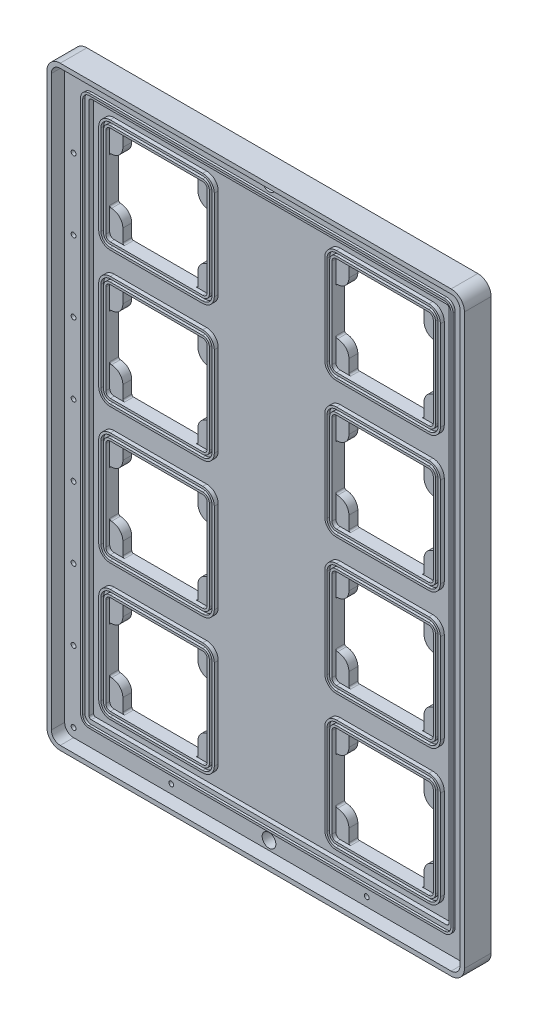
from build123d import *

# Parameters (mm, degrees)
SKETCH1_W            = 292.1
SKETCH1_H            = 419.1
BOSS_EXTRUDE1_DEPTH  = 9.525
SKETCH4_R            = 1.7272
CUT_EXTRUDE1_DEPTH   = 6.985
LPATTERN2_COUNT      = 8
LPATTERN2_PITCH      = 50.8
LPATTERN3_COUNT      = 4
LPATTERN3_PITCH      = 69.85
CUT_EXTRUDE3_DEPTH   = 3.175
BOSS_EXTRUDE2_DEPTH  = 1.5875
SKETCH7_R            = 4.9022
CUT_EXTRUDE4_DEPTH   = 511.938299235
FILLET1_R            = 6.35
CUT_EXTRUDE5_DEPTH   = 3.175
CUT_EXTRUDE6_DEPTH   = 511.970358882
SKETCH11_R           = 1.1303
CUT_EXTRUDE7_DEPTH   = 3.96875
BOSS_EXTRUDE3_DEPTH  = 2.794
BOSS_EXTRUDE4_DEPTH  = 0.79375
LPATTERN1_COUNT      = 2
LPATTERN1_PITCH      = 161.5948
LPATTERN1_COUNT_DIR2 = 4
LPATTERN1_PITCH_DIR2 = 96.8756
BOSS_EXTRUDE5_START  = -19.05
BOSS_EXTRUDE5_DEPTH  = 19.05


with BuildPart() as part:
    # Sketch1 → Boss-Extrude1 (new body)
    with BuildSketch(Plane.XY):
        with Locations((146.05, 209.55)):
            Rectangle(SKETCH1_W, SKETCH1_H)
    extrude(amount=BOSS_EXTRUDE1_DEPTH)

    # Sketch4 → Cut-Extrude1 (cut)
    with BuildSketch(Plane.XY.offset(9.525)):
        with Locations((6.35, 6.35)):
            Circle(SKETCH4_R)
        with Locations((6.35, 412.75)):
            Circle(SKETCH4_R)
        with Locations((285.75, 412.75)):
            Circle(SKETCH4_R)
        with Locations((285.75, 6.35)):
            Circle(SKETCH4_R)
    cut_extrude1 = extrude(amount=-CUT_EXTRUDE1_DEPTH, mode=Mode.SUBTRACT)

    # LPattern2: Cut-Extrude1 ×8
    with Locations(*[(0, -i * LPATTERN2_PITCH, 0) for i in range(1, LPATTERN2_COUNT)]):
        add(cut_extrude1, mode=Mode.SUBTRACT)

    # LPattern3: Cut-Extrude1 ×4
    with Locations(*[(-i * LPATTERN3_PITCH, 0, 0) for i in range(1, LPATTERN3_COUNT)]):
        add(cut_extrude1, mode=Mode.SUBTRACT)

    # Sketch6 → Cut-Extrude3 (cut)
    with BuildSketch(Plane.XY.offset(9.525)):
        with BuildLine():
            Line((273.05, 401.6375), (19.05, 401.6375))
            ThreePointArc((19.05, 401.6375), (17.927467985, 401.172532015), (17.4625, 400.05))
            Line((17.4625, 400.05), (17.4625, 19.05))
            ThreePointArc((17.4625, 19.05), (17.927467985, 17.927467985), (19.05, 17.4625))
            Line((19.05, 17.4625), (273.05, 17.4625))
            ThreePointArc((273.05, 17.4625), (274.172532015, 17.927467985), (274.6375, 19.05))
            Line((274.6375, 19.05), (274.6375, 400.05))
            ThreePointArc((274.6375, 400.05), (274.172532015, 401.172532015), (273.05, 401.6375))
        make_face()
    extrude(amount=-CUT_EXTRUDE3_DEPTH, mode=Mode.SUBTRACT)

    # Sketch5 → Boss-Extrude2 (add)
    with BuildSketch(Plane.XY.offset(9.525)):
        with BuildLine():
            ThreePointArc((19.05, 406.146), (14.739477062, 404.360522938), (12.954, 400.05))
            Line((12.954, 400.05), (12.954, 19.05))
            ThreePointArc((12.954, 19.05), (14.739477062, 14.739477062), (19.05, 12.954))
            Line((19.05, 12.954), (273.05, 12.954))
            ThreePointArc((273.05, 12.954), (277.360522938, 14.739477062), (279.146, 19.05))
            Line((279.146, 19.05), (279.146, 400.05))
            ThreePointArc((279.146, 400.05), (277.360522938, 404.360522938), (273.05, 406.146))
            Line((273.05, 406.146), (19.05, 406.146))
        make_face()
        with BuildLine():
            ThreePointArc((273.05, 404.622), (276.282892204, 403.282892204), (277.622, 400.05))
            Line((277.622, 400.05), (277.622, 19.05))
            ThreePointArc((277.622, 19.05), (276.282892204, 15.817107796), (273.05, 14.478))
            Line((273.05, 14.478), (19.05, 14.478))
            ThreePointArc((19.05, 14.478), (15.817107796, 15.817107796), (14.478, 19.05))
            Line((14.478, 19.05), (14.478, 400.05))
            ThreePointArc((14.478, 400.05), (15.817107796, 403.282892204), (19.05, 404.622))
            Line((19.05, 404.622), (273.05, 404.622))
        make_face(mode=Mode.SUBTRACT)
    extrude(amount=BOSS_EXTRUDE2_DEPTH)

    # Sketch7 → Cut-Extrude4 (cut, through all)
    with BuildSketch(Plane.XY.offset(9.525)):
        with Locations((146.05, 6.35)):
            Circle(SKETCH7_R)
        with Locations((146.05, 412.75)):
            Circle(SKETCH7_R)
    extrude(amount=-CUT_EXTRUDE4_DEPTH, mode=Mode.SUBTRACT)

    # Fillet1
    fillet1_edges = [part.edges().sort_by_distance(p)[0] for p in [
        (0, 419.1, 4.7625),
        (292.1, 419.1, 4.7625),
        (0, 0, 4.7625),
        (292.1, 0, 4.7625),
    ]]
    fillet(fillet1_edges, radius=FILLET1_R)

    # Sketch8 → Cut-Extrude5 (cut)
    with BuildSketch(Plane(origin=(0, 0, 0), x_dir=(-1, 0, 0), z_dir=(0, 0, -1))):
        with BuildLine():
            Line((-201.2442, 393.7), (-252.4506, 393.7))
            ThreePointArc((-252.4506, 393.7), (-255.881057838, 392.279057838), (-257.302, 388.8486))
            Line((-257.302, 388.8486), (-257.302, 379.857))
            ThreePointArc((-257.302, 379.857), (-258.633668309, 376.642068309), (-261.8486, 375.3104))
            ThreePointArc((-261.8486, 375.3104), (-265.279057838, 373.889457838), (-266.7, 370.459))
            Line((-266.7, 370.459), (-266.7, 339.2678))
            ThreePointArc((-266.7, 339.2678), (-265.279057838, 335.837342162), (-261.8486, 334.4164))
            ThreePointArc((-261.8486, 334.4164), (-258.633668309, 333.084731691), (-257.302, 329.8698))
            Line((-257.302, 329.8698), (-257.302, 320.8782))
            ThreePointArc((-257.302, 320.8782), (-255.881057838, 317.447742162), (-252.4506, 316.0268))
            Line((-252.4506, 316.0268), (-201.2442, 316.0268))
            ThreePointArc((-201.2442, 316.0268), (-197.813742162, 317.447742162), (-196.3928, 320.8782))
            Line((-196.3928, 320.8782), (-196.3928, 329.8698))
            ThreePointArc((-196.3928, 329.8698), (-195.061131691, 333.084731691), (-191.8462, 334.4164))
            ThreePointArc((-191.8462, 334.4164), (-188.415742162, 335.837342162), (-186.9948, 339.2678))
            Line((-186.9948, 339.2678), (-186.9948, 370.459))
            ThreePointArc((-186.9948, 370.459), (-188.415742162, 373.889457838), (-191.8462, 375.3104))
            ThreePointArc((-191.8462, 375.3104), (-195.061131691, 376.642068309), (-196.3928, 379.857))
            Line((-196.3928, 379.857), (-196.3928, 388.8486))
            ThreePointArc((-196.3928, 388.8486), (-197.813742162, 392.279057838), (-201.2442, 393.7))
        make_face()
        with BuildLine():
            Line((-264.668, 370.459), (-264.668, 339.2678))
            ThreePointArc((-264.668, 339.2678), (-263.842216859, 337.274183141), (-261.8486, 336.4484))
            ThreePointArc((-261.8486, 336.4484), (-257.196827329, 334.521572671), (-255.27, 329.8698))
            Line((-255.27, 329.8698), (-255.27, 320.8782))
            ThreePointArc((-255.27, 320.8782), (-254.444216859, 318.884583141), (-252.4506, 318.0588))
            Line((-252.4506, 318.0588), (-201.2442, 318.0588))
            ThreePointArc((-201.2442, 318.0588), (-199.250583141, 318.884583141), (-198.4248, 320.8782))
            Line((-198.4248, 320.8782), (-198.4248, 329.8698))
            ThreePointArc((-198.4248, 329.8698), (-196.497972671, 334.521572671), (-191.8462, 336.4484))
            ThreePointArc((-191.8462, 336.4484), (-189.852583141, 337.274183141), (-189.0268, 339.2678))
            Line((-189.0268, 339.2678), (-189.0268, 370.459))
            ThreePointArc((-189.0268, 370.459), (-189.852583141, 372.452616859), (-191.8462, 373.2784))
            ThreePointArc((-191.8462, 373.2784), (-196.497972671, 375.205227329), (-198.4248, 379.857))
            Line((-198.4248, 379.857), (-198.4248, 388.8486))
            ThreePointArc((-198.4248, 388.8486), (-199.250583141, 390.842216859), (-201.2442, 391.668))
            Line((-201.2442, 391.668), (-252.4506, 391.668))
            ThreePointArc((-252.4506, 391.668), (-254.444216859, 390.842216859), (-255.27, 388.8486))
            Line((-255.27, 388.8486), (-255.27, 379.857))
            ThreePointArc((-255.27, 379.857), (-257.196827329, 375.205227329), (-261.8486, 373.2784))
            ThreePointArc((-261.8486, 373.2784), (-263.842216859, 372.452616859), (-264.668, 370.459))
        make_face(mode=Mode.SUBTRACT)
    cut_extrude5 = extrude(amount=-CUT_EXTRUDE5_DEPTH, mode=Mode.SUBTRACT)

    # Sketch10 → Cut-Extrude6 (cut, through all)
    with BuildSketch(Plane(origin=(0, 0, 0), x_dir=(-1, 0, 0), z_dir=(0, 0, -1))):
        with BuildLine():
            Line((-263.0805, 370.459), (-263.0805, 339.2678))
            ThreePointArc((-263.0805, 339.2678), (-262.719684844, 338.396715156), (-261.8486, 338.0359))
            ThreePointArc((-261.8486, 338.0359), (-256.074295314, 335.644104686), (-253.6825, 329.8698))
            Line((-253.6825, 329.8698), (-253.6825, 320.8782))
            ThreePointArc((-253.6825, 320.8782), (-253.321684844, 320.007115156), (-252.4506, 319.6463))
            Line((-252.4506, 319.6463), (-201.2442, 319.6463))
            ThreePointArc((-201.2442, 319.6463), (-200.373115156, 320.007115156), (-200.0123, 320.8782))
            Line((-200.0123, 320.8782), (-200.0123, 329.8698))
            ThreePointArc((-200.0123, 329.8698), (-197.620504686, 335.644104686), (-191.8462, 338.0359))
            ThreePointArc((-191.8462, 338.0359), (-190.975115156, 338.396715156), (-190.6143, 339.2678))
            Line((-190.6143, 339.2678), (-190.6143, 370.459))
            ThreePointArc((-190.6143, 370.459), (-190.975115156, 371.330084844), (-191.8462, 371.6909))
            ThreePointArc((-191.8462, 371.6909), (-197.620504686, 374.082695314), (-200.0123, 379.857))
            Line((-200.0123, 379.857), (-200.0123, 388.8486))
            ThreePointArc((-200.0123, 388.8486), (-200.373115156, 389.719684844), (-201.2442, 390.0805))
            Line((-201.2442, 390.0805), (-252.4506, 390.0805))
            ThreePointArc((-252.4506, 390.0805), (-253.321684844, 389.719684844), (-253.6825, 388.8486))
            Line((-253.6825, 388.8486), (-253.6825, 379.857))
            ThreePointArc((-253.6825, 379.857), (-256.074295314, 374.082695314), (-261.8486, 371.6909))
            ThreePointArc((-261.8486, 371.6909), (-262.719684844, 371.330084844), (-263.0805, 370.459))
        make_face()
    cut_extrude6 = extrude(amount=-CUT_EXTRUDE6_DEPTH, mode=Mode.SUBTRACT)

    # Sketch11 → Cut-Extrude7 (cut)
    with BuildSketch(Plane(origin=(0, 0, 0), x_dir=(-1, 0, 0), z_dir=(0, 0, -1))):
        with Locations((-261.8486, 388.8994)):
            Circle(SKETCH11_R)
        with Locations((-191.8462, 388.8994)):
            Circle(SKETCH11_R)
        with Locations((-191.8462, 320.8274)):
            Circle(SKETCH11_R)
        with Locations((-261.8486, 320.8274)):
            Circle(SKETCH11_R)
    cut_extrude7 = extrude(amount=-CUT_EXTRUDE7_DEPTH, mode=Mode.SUBTRACT)

    # Sketch12 → Boss-Extrude3 (add)
    # profile 1 of 2: a face of its own
    with BuildSketch(Plane.XY.offset(6.35)):
        with BuildLine():
            ThreePointArc((193.7893, 395.1605), (187.952133521, 392.742666479), (185.5343, 386.9055))
            Line((185.5343, 386.9055), (185.5343, 322.8213))
            ThreePointArc((185.5343, 322.8213), (187.952133521, 316.984133521), (193.7893, 314.5663))
            Line((193.7893, 314.5663), (259.9055, 314.5663))
            ThreePointArc((259.9055, 314.5663), (265.742666479, 316.984133521), (268.1605, 322.8213))
            Line((268.1605, 322.8213), (268.1605, 386.9055))
            ThreePointArc((268.1605, 386.9055), (265.742666479, 392.742666479), (259.9055, 395.1605))
            Line((259.9055, 395.1605), (193.7893, 395.1605))
        make_face()
        with BuildLine():
            Line((187.1218, 322.8213), (187.1218, 386.9055))
            ThreePointArc((187.1218, 386.9055), (189.074665536, 391.620134464), (193.7893, 393.573))
            Line((193.7893, 393.573), (259.9055, 393.573))
            ThreePointArc((259.9055, 393.573), (264.620134464, 391.620134464), (266.573, 386.9055))
            Line((266.573, 386.9055), (266.573, 322.8213))
            ThreePointArc((266.573, 322.8213), (264.620134464, 318.106665536), (259.9055, 316.1538))
            Line((259.9055, 316.1538), (193.7893, 316.1538))
            ThreePointArc((193.7893, 316.1538), (189.074665536, 318.106665536), (187.1218, 322.8213))
        make_face(mode=Mode.SUBTRACT)
    # profile 2 of 2: a face of its own
    with BuildSketch(Plane.XY.offset(6.35)):
        with BuildLine():
            Line((259.9055, 391.668), (193.7893, 391.668))
            ThreePointArc((193.7893, 391.668), (190.421703955, 390.273096045), (189.0268, 386.9055))
            Line((189.0268, 386.9055), (189.0268, 322.8213))
            ThreePointArc((189.0268, 322.8213), (190.421703955, 319.453703955), (193.7893, 318.0588))
            Line((193.7893, 318.0588), (259.9055, 318.0588))
            ThreePointArc((259.9055, 318.0588), (263.273096045, 319.453703955), (264.668, 322.8213))
            Line((264.668, 322.8213), (264.668, 386.9055))
            ThreePointArc((264.668, 386.9055), (263.273096045, 390.273096045), (259.9055, 391.668))
        make_face()
        with BuildLine():
            ThreePointArc((190.6143, 386.9055), (191.54423597, 389.15056403), (193.7893, 390.0805))
            Line((193.7893, 390.0805), (259.9055, 390.0805))
            ThreePointArc((259.9055, 390.0805), (262.15056403, 389.15056403), (263.0805, 386.9055))
            Line((263.0805, 386.9055), (263.0805, 322.8213))
            ThreePointArc((263.0805, 322.8213), (262.15056403, 320.57623597), (259.9055, 319.6463))
            Line((259.9055, 319.6463), (193.7893, 319.6463))
            ThreePointArc((193.7893, 319.6463), (191.54423597, 320.57623597), (190.6143, 322.8213))
            Line((190.6143, 322.8213), (190.6143, 386.9055))
        make_face(mode=Mode.SUBTRACT)
    boss_extrude3 = extrude(amount=BOSS_EXTRUDE3_DEPTH)

    # Sketch12<3> → Boss-Extrude4 (add)
    with BuildSketch(Plane.XY.offset(6.35)):
        with BuildLine():
            ThreePointArc((193.7893, 393.573), (189.074665536, 391.620134464), (187.1218, 386.9055))
            Line((187.1218, 386.9055), (187.1218, 322.8213))
            ThreePointArc((187.1218, 322.8213), (189.074665536, 318.106665536), (193.7893, 316.1538))
            Line((193.7893, 316.1538), (259.9055, 316.1538))
            ThreePointArc((259.9055, 316.1538), (264.620134464, 318.106665536), (266.573, 322.8213))
            Line((266.573, 322.8213), (266.573, 386.9055))
            ThreePointArc((266.573, 386.9055), (264.620134464, 391.620134464), (259.9055, 393.573))
            Line((259.9055, 393.573), (193.7893, 393.573))
        make_face()
        with BuildLine():
            ThreePointArc((189.0268, 386.9055), (190.421703955, 390.273096045), (193.7893, 391.668))
            Line((193.7893, 391.668), (259.9055, 391.668))
            ThreePointArc((259.9055, 391.668), (263.273096045, 390.273096045), (264.668, 386.9055))
            Line((264.668, 386.9055), (264.668, 322.8213))
            ThreePointArc((264.668, 322.8213), (263.273096045, 319.453703955), (259.9055, 318.0588))
            Line((259.9055, 318.0588), (193.7893, 318.0588))
            ThreePointArc((193.7893, 318.0588), (190.421703955, 319.453703955), (189.0268, 322.8213))
            Line((189.0268, 322.8213), (189.0268, 386.9055))
        make_face(mode=Mode.SUBTRACT)
    boss_extrude4 = extrude(amount=BOSS_EXTRUDE4_DEPTH)

    # LPattern1: Cut-Extrude5, Cut-Extrude6, Cut-Extrude7, Boss-Extrude3, Boss-Extrude4 2 × 4
    with Locations(*[(-i * LPATTERN1_PITCH, -j * LPATTERN1_PITCH_DIR2, 0) for i in range(LPATTERN1_COUNT) for j in range(LPATTERN1_COUNT_DIR2) if (i, j) != (0, 0)]):
        add(cut_extrude5, mode=Mode.SUBTRACT)
        add(cut_extrude6, mode=Mode.SUBTRACT)
        add(cut_extrude7, mode=Mode.SUBTRACT)
        add(boss_extrude3)
        add(boss_extrude4)

    # Sketch13 → Boss-Extrude5 (add)
    with BuildSketch(Plane(origin=(0, 0, 0), x_dir=(-1, 0, 0), z_dir=(0, 0, -1)).offset(BOSS_EXTRUDE5_START)):
        with BuildLine():
            Line((-285.75, -3.175), (-6.35, -3.175))
            ThreePointArc((-6.35, -3.175), (0.385192091, -0.385192091), (3.175, 6.35))
            Line((3.175, 6.35), (3.175, 412.75))
            ThreePointArc((3.175, 412.75), (0.385192091, 419.485192091), (-6.35, 422.275))
            Line((-6.35, 422.275), (-285.75, 422.275))
            ThreePointArc((-285.75, 422.275), (-292.485192091, 419.485192091), (-295.275, 412.75))
            Line((-295.275, 412.75), (-295.275, 6.35))
            ThreePointArc((-295.275, 6.35), (-292.485192091, -0.385192091), (-285.75, -3.175))
        make_face()
        with BuildLine():
            Line((-6.35, 419.1), (-285.75, 419.1))
            ThreePointArc((-285.75, 419.1), (-290.240128061, 417.240128061), (-292.1, 412.75))
            Line((-292.1, 412.75), (-292.1, 6.35))
            ThreePointArc((-292.1, 6.35), (-290.240128061, 1.859871939), (-285.75, 0))
            Line((-285.75, 0), (-6.35, 0))
            ThreePointArc((-6.35, 0), (-1.859871939, 1.859871939), (0, 6.35))
            Line((0, 6.35), (0, 412.75))
            ThreePointArc((0, 412.75), (-1.859871939, 417.240128061), (-6.35, 419.1))
        make_face(mode=Mode.SUBTRACT)
    extrude(amount=BOSS_EXTRUDE5_DEPTH)


solid = part.part
